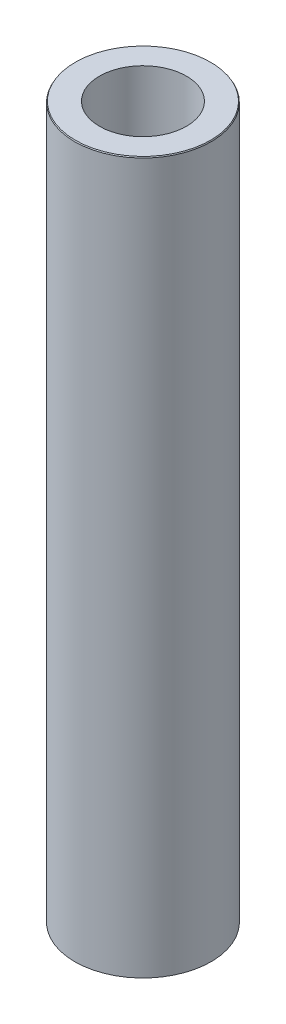
from build123d import *
from OCP.BRepFilletAPI import BRepFilletAPI_MakeChamfer

# Parameters (mm, degrees)
SKETCH1_R           = 57.5
BOSS_EXTRUDE1_DEPTH = 600
SKETCH2_R           = 36.67103458
CUT_EXTRUDE1_DEPTH  = 606.485342515
CHAMFER1_SIZE       = 0.858639744
CHAMFER1_SIZE2      = 0.495735888


with BuildPart() as part:
    # Sketch1 → Boss-Extrude1 (new body)
    with BuildSketch(Plane(origin=(0, 0, 0), x_dir=(1, 0, 0), z_dir=(0, 1, 0))):
        Circle(SKETCH1_R)
    extrude(amount=BOSS_EXTRUDE1_DEPTH)

    # Sketch2 → Cut-Extrude1 (cut, through all)
    with BuildSketch(Plane(origin=(0, 0, 0), x_dir=(1, 0, 0), z_dir=(0, 1, 0))):
        Circle(SKETCH2_R)
    extrude(amount=CUT_EXTRUDE1_DEPTH, mode=Mode.SUBTRACT)

    # Chamfer1: one chamfer whose edges measure the first distance from different faces: ONE call of the kernel's chamfer builder (chamfer() names one face for all edges)
    chamfer1_edges_1 = [part.edges().sort_by_distance(p)[0] for p in [
        (-57.5, 600, 0),
    ]]
    chamfer1_side_1 = [part.faces().sort_by_distance(p)[0] for p in [
        (-57.5, 300, 0),
    ]]
    chamfer1_edges_2 = [part.edges().sort_by_distance(p)[0] for p in [
        (-57.5, 0, 0),
    ]]
    chamfer1_side_2 = [part.faces().sort_by_distance(p)[0] for p in [
        (-55.873654403, 0, 0),
    ]]
    chamfer1 = BRepFilletAPI_MakeChamfer(part.part.solid().wrapped)
    for e in chamfer1_edges_1:
        chamfer1.Add(CHAMFER1_SIZE, CHAMFER1_SIZE2, e.wrapped, chamfer1_side_1[0].wrapped)  # the first distance lies on this face
    for e in chamfer1_edges_2:
        chamfer1.Add(CHAMFER1_SIZE, CHAMFER1_SIZE2, e.wrapped, chamfer1_side_2[0].wrapped)  # the first distance lies on this face
    add(Compound.cast(chamfer1.Shape()), mode=Mode.REPLACE)


solid = part.part
